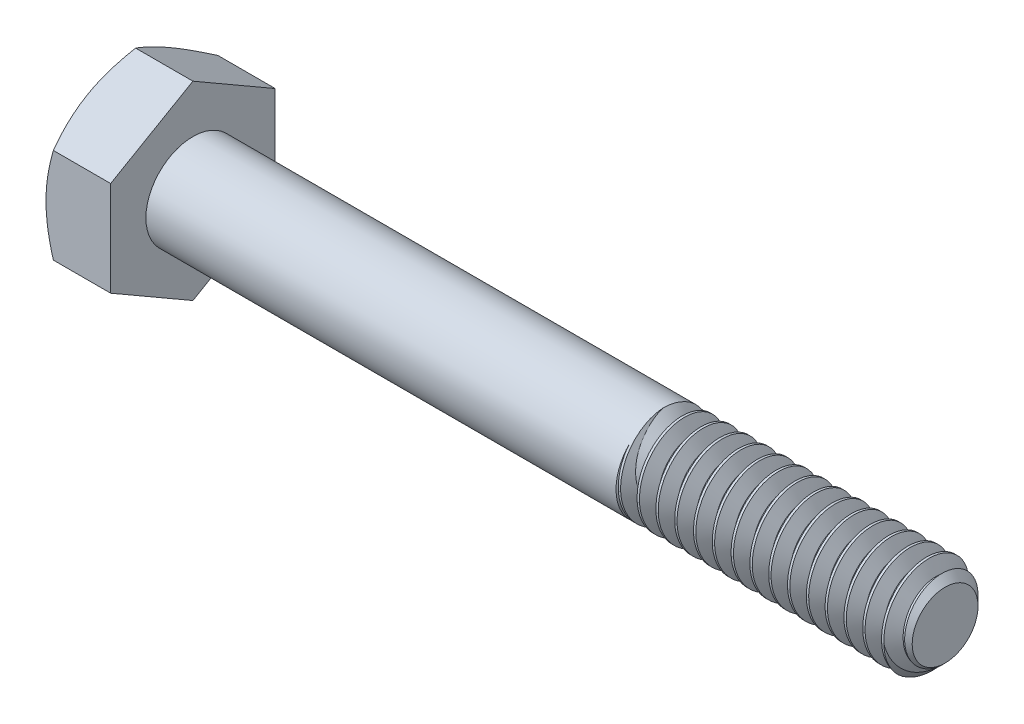
from build123d import *

# Parameters (mm, degrees)
SKETCH5_R           = 3.175
BOSS_EXTRUDE3_DEPTH = 50.8
CHAMFER1_SIZE       = 0.9525
CUT_SWEEP1_PITCH    = 1.27
BOSS_EXTRUDE4_DEPTH = 4.365625
SKETCH8_OUTSIDE_W   = 221.468
SKETCH8_OUTSIDE_H   = 223.188
SKETCH8_OUTSIDE_R   = 5.55625
CUT_EXTRUDE3_DEPTH  = 56.814699308
CUT_EXTRUDE3_DRAFT  = -60


with BuildPart() as part:
    # Sketch5 → Boss-Extrude3 (new body)
    with BuildSketch(Plane(origin=(27.5828125, 0, 0), x_dir=(0, 0, -1), z_dir=(1, 0, 0))):
        Circle(SKETCH5_R)
    extrude(amount=-BOSS_EXTRUDE3_DEPTH)

    # Chamfer1
    chamfer1_edges = [part.edges().sort_by_distance(p)[0] for p in [
        (27.5828125, 0, 3.175),
    ]]
    chamfer(chamfer1_edges, length=CHAMFER1_SIZE)

    # Cut-Sweep1: the profile of Sketch10 profile screwed along a right-hand helix of 16 turns, 8 arcs to a turn; built about Z, then put on its axis
    cut_sweep1_z = Axis((0, 0, 0), (0, 0, 1))
    cut_sweep1_corners = [(3.1753, 0, 0.000173205), (2.350110803, 0, -0.47625), (2.350110803, 0, -0.635), (3.1753, 0, -1.111423205)]
    with BuildLine(mode=Mode.PRIVATE) as cut_sweep1_profile:
        Line(cut_sweep1_corners[0], cut_sweep1_corners[1])
        Line(cut_sweep1_corners[1], cut_sweep1_corners[2])
        Line(cut_sweep1_corners[2], cut_sweep1_corners[3])
        Line(cut_sweep1_corners[3], cut_sweep1_corners[0])
    cut_sweep1_cap = Face(cut_sweep1_profile.wire())
    cut_sweep1_turn_angles = [0, 22.5, 45, 67.5, 90, 112.5, 135, 157.5, 180, 202.5, 225, 247.5, 270, 292.5, 315, 337.5, 360]
    cut_sweep1_turn_weights = [1, 0.9238795325112867, 1, 0.9238795325112867, 1, 0.9238795325112867, 1, 0.9238795325112867, 1, 0.9238795325112867, 1, 0.9238795325112867, 1, 0.9238795325112867, 1, 0.9238795325112867, 1]
    cut_sweep1_turn_rails = [Edge.make_bspline([Vector(p[0], p[1], 0).rotate(cut_sweep1_z, cut_sweep1_turn_angles[k]) / cut_sweep1_turn_weights[k] + Vector(0, 0, p[2] + CUT_SWEEP1_PITCH * cut_sweep1_turn_angles[k] / 360) for k in range(17)], [0, 0, 0, 1, 1, 2, 2, 3, 3, 4, 4, 5, 5, 6, 6, 7, 7, 8, 8, 8], 2, cut_sweep1_turn_weights) for p in cut_sweep1_corners]
    cut_sweep1_turn_sides = [Face.make_surface_from_curves(cut_sweep1_turn_rails[p[0]], cut_sweep1_turn_rails[p[1]]) for p in [(0, 1), (1, 2), (2, 3), (3, 0)]]
    cut_sweep1 = Plane(origin=(27.5828125, 0, 0), x_dir=(0, 1, 0), z_dir=(-1, 0, 0)) * Solid(Shell([*[p.moved(Location((0, 0, CUT_SWEEP1_PITCH * i))) for i in range(16) for p in cut_sweep1_turn_sides], cut_sweep1_cap, cut_sweep1_cap.rotate(cut_sweep1_z, 5760).moved(Location((0, 0, CUT_SWEEP1_PITCH * 5760 / 360)))]))
    add(cut_sweep1, mode=Mode.SUBTRACT)

    # Sketch11 → Revolve1 (revolve)
    with BuildSketch(Plane.XY, mode=Mode.PRIVATE) as revolve1_sk:
        Polygon((-23.2171875, 3.175), (-23.2171875, 0), (11.7078125, 0), (8.5328125, 3.175), align=None)
    revolve(revolve1_sk.sketch.rotate(Axis((-23.2171875, 0, 0), (1, 0, 0)), 270), axis=Axis((-23.2171875, 0, 0), (1, 0, 0)))

    # Sketch6 → Boss-Extrude4 (add)
    with BuildSketch(Plane.ZY.offset(23.2171875)):
        Polygon((5.55625, 3.207902433), (0, 6.415804866), (-5.55625, 3.207902433), (-5.55625, -3.207902433), (0, -6.415804866), (5.55625, -3.207902433), align=None)
    extrude(amount=BOSS_EXTRUDE4_DEPTH)


with BuildPart() as cut_extrude3_tool:
    # Sketch8 outside → Cut-Extrude3 (with draft: the straight prism first)
    with BuildSketch(Plane.ZY.offset(27.5828125)):
        Rectangle(SKETCH8_OUTSIDE_W, SKETCH8_OUTSIDE_H)
        Circle(SKETCH8_OUTSIDE_R, mode=Mode.SUBTRACT)
    extrude(amount=-CUT_EXTRUDE3_DEPTH)
    # Cut-Extrude3: the draft: its side faces are tilted about the plane it starts from
    cut_extrude3_sides = [cut_extrude3_tool.faces().sort_by_distance(p)[0] for p in [
        (0.824537154, -111.594, 0),
        (0.824537154, 0, 110.734),
        (0.824537154, 111.594, 0),
        (0.824537154, 0, -110.734),
        (0.824537154, 0, -5.55625),
    ]]
    draft(cut_extrude3_sides, Plane.ZY.offset(27.5828125), CUT_EXTRUDE3_DRAFT)


with BuildPart() as part_1:
    add(part.part)

    # Cut-Extrude3: cut by cut_extrude3_tool
    add(cut_extrude3_tool.part, mode=Mode.SUBTRACT)


solid = part_1.part
